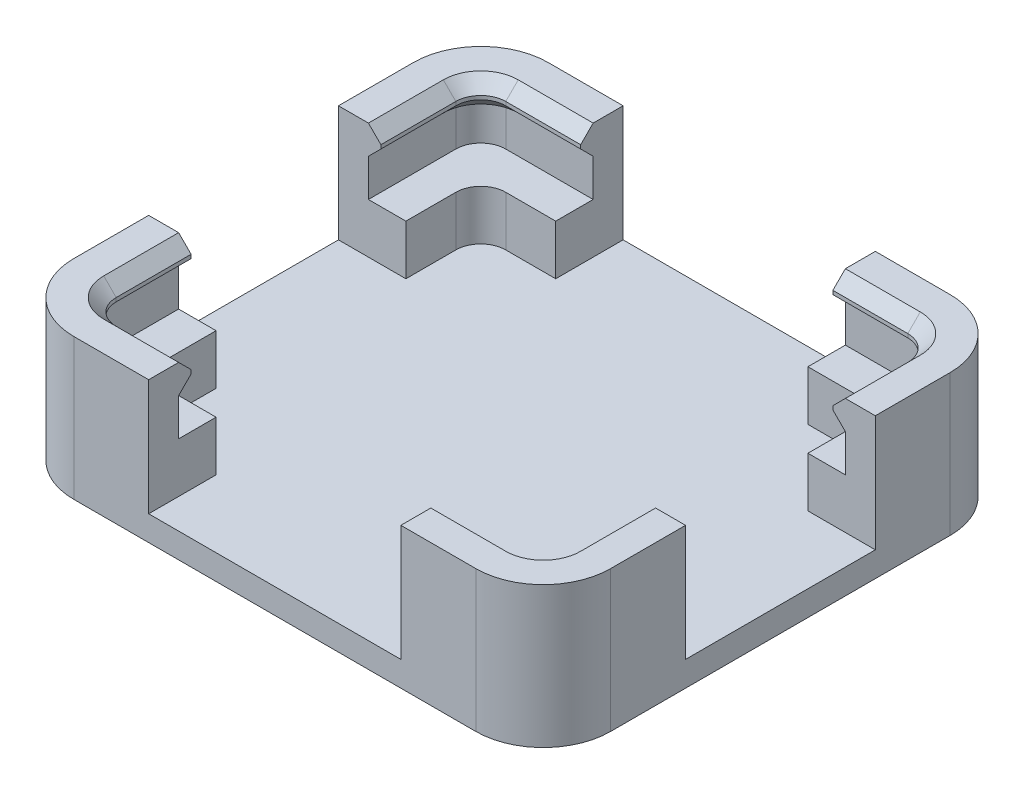
from build123d import *

# Parameters (mm, degrees)
SKETCH1_W              = 21.5
SKETCH1_H              = 19
COMBINE_BASE_DEPTH     = 1
STAND_OFFS_DEPTH       = 2
PCB_CONTAINERS_DEPTH   = 1.5
SNAP_INS_DEPTH         = 1.15
INSIDE_FILLETS_R       = 1
OUTSIDE_FILLETS_R      = 2.7
CLICK_IN_CHAMFERS_SIZE = 0.5
PULL_OUT_CHAMFERS_SIZE = 0.5


with BuildPart() as part:
    # Sketch1 → Combine Base (new body)
    with BuildSketch(Plane(origin=(0, 0, 0), x_dir=(1, 0, 0), z_dir=(0, 1, 0))):
        Rectangle(SKETCH1_W, SKETCH1_H)
    extrude(amount=COMBINE_BASE_DEPTH)

    # Sketch4 → Stand offs (add)
    with BuildSketch(Plane(origin=(0, 1, 0), x_dir=(1, 0, 0), z_dir=(0, 1, 0))):
        Polygon((-10.75, 3.8), (-8.05, 3.8), (-8.05, 6.8), (-5.05, 6.8), (-5.05, 9.5), (-10.75, 9.5), align=None)
        Polygon((-8.05, -3.8), (-10.75, -3.8), (-10.75, -9.5), (-5.05, -9.5), (-5.05, -6.8), (-8.05, -6.8), align=None)
        Polygon((5.05, -6.8), (5.05, -9.5), (10.75, -9.5), (10.75, -3.8), (8.05, -3.8), (8.05, -6.8), align=None)
        Polygon((10.75, 9.5), (5.05, 9.5), (5.05, 6.8), (8.05, 6.8), (8.05, 3.8), (10.75, 3.8), align=None)
    extrude(amount=STAND_OFFS_DEPTH)

    # Sketch5 → PCB Containers (add)
    with BuildSketch(Plane(origin=(0, 3, 0), x_dir=(1, 0, 0), z_dir=(0, 1, 0))):
        Polygon((-10.75, 3.8), (-9.55, 3.8), (-9.55, 8.3), (-5.05, 8.3), (-5.05, 9.5), (-10.75, 9.5), align=None)
        Polygon((9.55, 8.3), (9.55, 3.8), (10.75, 3.8), (10.75, 9.5), (5.05, 9.5), (5.05, 8.3), align=None)
        Polygon((9.55, -8.3), (5.05, -8.3), (5.05, -9.5), (10.75, -9.5), (10.75, -3.8), (9.55, -3.8), align=None)
        Polygon((-10.75, -9.5), (-5.05, -9.5), (-5.05, -8.3), (-9.55, -8.3), (-9.55, -3.8), (-10.75, -3.8), align=None)
    extrude(amount=PCB_CONTAINERS_DEPTH)

    # Sketch6 → Snap Ins (add)
    with BuildSketch(Plane(origin=(0, 4.5, 0), x_dir=(1, 0, 0), z_dir=(0, 1, 0))):
        Polygon((-5.05, 7.8), (-5.05, 9.5), (-10.75, 9.5), (-10.75, 3.8), (-9.05, 3.8), (-9.05, 7.8), align=None)
        Polygon((-9.05, -3.8), (-10.75, -3.8), (-10.75, -9.5), (-5.05, -9.5), (-5.05, -7.8), (-9.05, -7.8), align=None)
        Polygon((10.75, -9.5), (10.75, -3.8), (9.05, -3.8), (9.05, -7.8), (5.05, -7.8), (5.05, -9.5), align=None)
        Polygon((10.75, 9.5), (5.05, 9.5), (5.05, 7.8), (9.05, 7.8), (9.05, 3.8), (10.75, 3.8), align=None)
    extrude(amount=SNAP_INS_DEPTH)

    # Inside Fillets
    inside_fillets_edges = [part.edges().sort_by_distance(p)[0] for p in [
        (9.55, 3.75, -8.3),
        (9.55, 3.75, 8.3),
        (-9.55, 3.75, 8.3),
        (-9.05, 5.075, 7.8),
        (9.05, 5.075, 7.8),
        (-8.05, 2, -6.8),
        (9.05, 5.075, -7.8),
        (-9.05, 5.075, -7.8),
        (-8.05, 2, 6.8),
        (8.05, 2, 6.8),
        (8.05, 2, -6.8),
        (-9.55, 3.75, -8.3),
    ]]
    fillet(inside_fillets_edges, radius=INSIDE_FILLETS_R)

    # Outside Fillets
    outside_fillets_edges = [part.edges().sort_by_distance(p)[0] for p in [
        (10.75, 2.825, 9.5),
        (-10.75, 2.825, 9.5),
        (-10.75, 2.825, -9.5),
        (10.75, 2.825, -9.5),
    ]]
    fillet(outside_fillets_edges, radius=OUTSIDE_FILLETS_R)

    # Click in Chamfers
    click_in_chamfers_edges = [part.edges().sort_by_distance(p)[0] for p in [
        (-9.05, 5.65, 5.3),
        (9.05, 5.65, 5.3),
        (6.55, 5.65, -7.8),
        (-9.05, 5.65, -5.3),
        (6.55, 5.65, 7.8),
        (-6.55, 5.65, 7.8),
        (-6.55, 5.65, -7.8),
        (9.05, 5.65, -5.3),
        (8.757106781, 5.65, 7.507106781),
        (-8.757106781, 5.65, 7.507106781),
        (-8.757106781, 5.65, -7.507106781),
        (8.757106781, 5.65, -7.507106781),
    ]]
    chamfer(click_in_chamfers_edges, length=CLICK_IN_CHAMFERS_SIZE)

    # Pull out Chamfers
    pull_out_chamfers_edges = [part.edges().sort_by_distance(p)[0] for p in [
        (-6.55, 4.5, -7.8),
        (-9.05, 4.5, -5.3),
        (-8.757106781, 4.5, -7.507106781),
        (9.05, 4.5, -5.3),
        (6.55, 4.5, -7.8),
        (8.757106781, 4.5, -7.507106781),
        (6.55, 4.5, 7.8),
        (9.05, 4.5, 5.3),
        (8.757106781, 4.5, 7.507106781),
        (-9.05, 4.5, 5.3),
        (-6.55, 4.5, 7.8),
        (-8.757106781, 4.5, 7.507106781),
    ]]
    chamfer(pull_out_chamfers_edges, length=PULL_OUT_CHAMFERS_SIZE - 0.0001)  # a hair under: the kernel refuses the full size


solid = part.part
